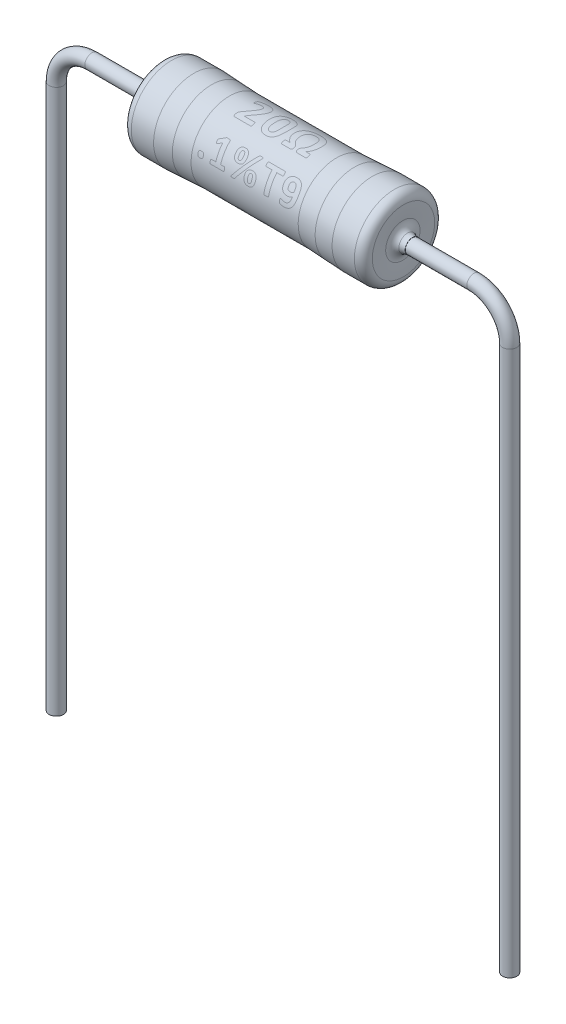
from build123d import *

# Parameters (mm, degrees)
SKETCH_WIRE_DIAMETER_R = 0.4
FILLET1_R              = 0.5
FILLET2_R              = 0.5


with BuildPart() as part:
    # SET WIRE LENGTH: sweep along a path in Sketch Wire Length
    with BuildLine(Plane.XY) as set_wire_length_path:
        Line((12.7, -32.508407346), (12.7, -2))
        ThreePointArc((12.7, -2), (12.114213562, -0.585786438), (10.7, 0))
        Line((10.7, 0), (-10.7, 0))
        ThreePointArc((-10.7, 0), (-12.114213562, -0.585786438), (-12.7, -2))
        Line((-12.7, -2), (-12.7, -32.508407346))
    # Sketch Wire Diameter → SET WIRE LENGTH (sweep)
    with BuildSketch(Plane(origin=(0, 0, 0), x_dir=(0, 0, -1), z_dir=(1, 0, 0))):
        Circle(SKETCH_WIRE_DIAMETER_R)
    sweep(path=set_wire_length_path.line)


with BuildPart() as body_2:
    # Sketch4 → Revolve1 (revolve)
    with BuildSketch(Plane.XY):
        with BuildLine():
            Line((-7.25, 0), (7.25, 0))
            Line((7.25, 0), (7.25, 0.41))
            ThreePointArc((7.25, 0.41), (6.909963237, 0.520574451), (6.7, 0.81))
            ThreePointArc((6.7, 0.81), (6.737492197, 1.30937539), (6.75, 1.81))
            Line((6.75, 1.81), (6.75, 2.25))
            Line((6.75, 2.25), (5, 2.25))
            ThreePointArc((5, 2.25), (4.49937539, 2.237492197), (4, 2.2))
            ThreePointArc((4, 2.2), (3.50062461, 2.162507803), (3, 2.15))
            Line((3, 2.15), (-3, 2.15))
            ThreePointArc((-3, 2.15), (-3.50062461, 2.162507803), (-4, 2.2))
            ThreePointArc((-4, 2.2), (-4.49937539, 2.237492197), (-5, 2.25))
            Line((-5, 2.25), (-6.75, 2.25))
            Line((-6.75, 2.25), (-6.75, 1.81))
            ThreePointArc((-6.75, 1.81), (-6.737492197, 1.30937539), (-6.7, 0.81))
            ThreePointArc((-6.7, 0.81), (-6.909963237, 0.520574451), (-7.25, 0.41))
            Line((-7.25, 0.41), (-7.25, 0))
        make_face()
    revolve(axis=Axis((-7.25, 0, 0), (1, 0, 0)))

    # Fillet1
    fillet1_edges = [body_2.edges().sort_by_distance(p)[0] for p in [
        (6.7, -0.81, 0),
        (-6.7, -0.81, 0),
    ]]
    fillet(fillet1_edges, radius=FILLET1_R)

    # Fillet2
    fillet2_edges = [body_2.edges().sort_by_distance(p)[0] for p in [
        (6.75, -2.25, 0),
        (-6.75, -2.25, 0),
    ]]
    fillet(fillet2_edges, radius=FILLET2_R)


solid = Compound([part.part, body_2.part])
